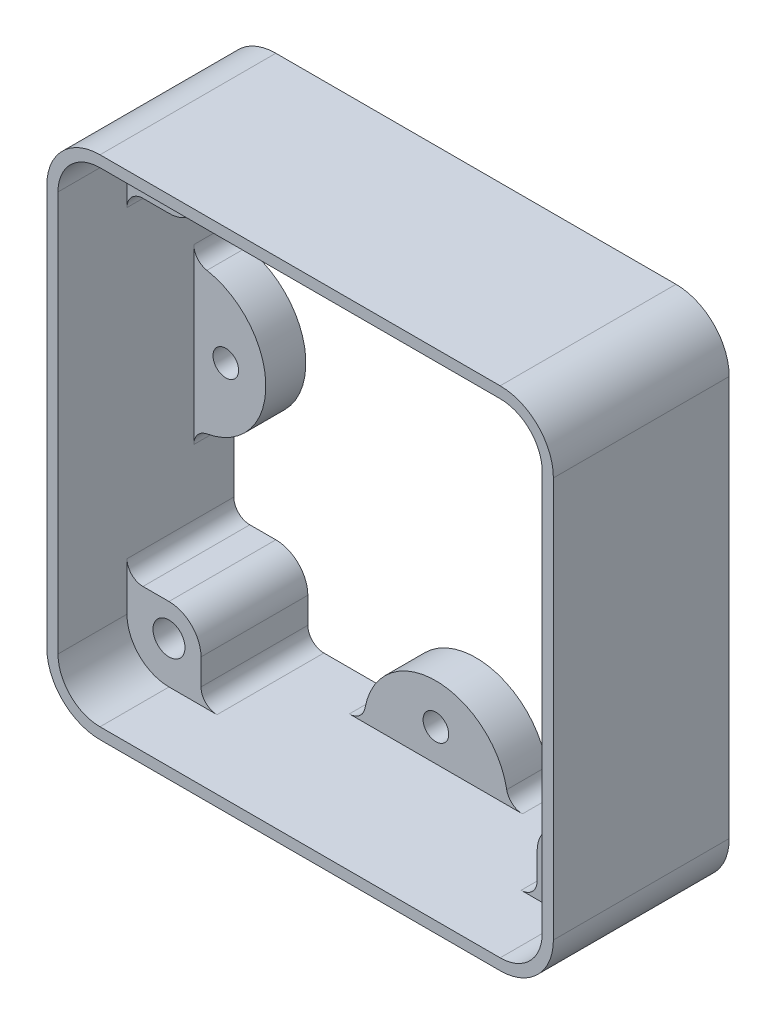
from build123d import *

# Parameters (mm, degrees)
BOSS_EXTRUDE1_DEPTH      = 7
BOSS_EXTRUDE1_DEPTH_BACK = 14.970201
BOSS_EXTRUDE2_START      = -14.970201
SKETCH2_R                = 2
BOSS_EXTRUDE2_DEPTH      = 13.350798149
BOSS_EXTRUDE3_START      = -14.970203
SKETCH3_R                = 1.6
BOSS_EXTRUDE3_DEPTH      = 5.000003
FILLET1_R                = 2


with BuildPart() as part:
    # Sketch1 → Boss-Extrude1 (new, two sides: drawn at the far end of the back side and taken through both)
    with BuildSketch(Plane.XY.offset(-BOSS_EXTRUDE1_DEPTH_BACK)):
        with BuildLine():
            Line((54.999742941, -1.649999966), (5.000257256, -1.649999966))
            ThreePointArc((5.000257256, -1.649999966), (0.297273819, 0.297273819), (-1.649999966, 5.000257256))
            Line((-1.649999966, 5.000257256), (-1.649999966, 54.999742941))
            ThreePointArc((-1.649999966, 54.999742941), (0.297274177, 59.702725823), (5.000257059, 61.649999966))
            Line((5.000257059, 61.649999966), (54.999743139, 61.649999966))
            ThreePointArc((54.999743139, 61.649999966), (59.702725466, 59.702725466), (61.649999966, 54.999743139))
            Line((61.649999966, 54.999743139), (61.649999966, 5.000257059))
            ThreePointArc((61.649999966, 5.000257059), (59.702725823, 0.297274177), (54.999742941, -1.649999966))
        make_face()
        with BuildLine():
            ThreePointArc((5.000039752, 60.249999994), (1.287223653, 58.712776347), (-0.249999994, 54.999960248))
            Line((-0.249999994, 54.999960248), (-0.249999994, 5.000039782))
            ThreePointArc((-0.249999994, 5.000039782), (1.287223296, 1.287223296), (5.000039782, -0.249999994))
            Line((5.000039782, -0.249999994), (54.999960248, -0.249999994))
            ThreePointArc((54.999960248, -0.249999994), (58.712776347, 1.287223653), (60.249999994, 5.000039752))
            Line((60.249999994, 5.000039752), (60.249999994, 54.999960279))
            ThreePointArc((60.249999994, 54.999960279), (58.712775989, 58.712775989), (54.999960279, 60.249999994))
            Line((54.999960279, 60.249999994), (5.000039752, 60.249999994))
        make_face(mode=Mode.SUBTRACT)
    extrude(amount=BOSS_EXTRUDE1_DEPTH + BOSS_EXTRUDE1_DEPTH_BACK)


with BuildPart() as boss_extrude2_tool:
    # Sketch2 → Boss-Extrude2 (new body)
    # profile 1 of 4: a face of its own
    with BuildSketch(Plane.XY.offset(BOSS_EXTRUDE2_START)):
        with BuildLine():
            Line((9.00000016, 54.99999922), (9.00000016, 60.249999994))
            Line((9.00000016, 60.249999994), (5.000039752, 60.249999994))
            add(Edge.make_bspline(
                [(-0.249999994, 54.999960248), (-0.250954892, 58.075921633), (1.924078367, 60.250954892), (5.000039752, 60.249999994)],
                knots=[0, 0, 0, 0, 1, 1, 1, 1], degree=3, weights=[1, 0.804591489, 0.804591489, 1]))
            Line((-0.249999994, 54.999960248), (-0.249999994, 50.99999922))
            Line((-0.249999994, 50.99999922), (5.00000016, 50.99999922))
            ThreePointArc((5.00000016, 50.99999922), (7.828427285, 52.171572095), (9.00000016, 54.99999922))
        make_face()
        with Locations(Location((5.00000016, 54.99999922, 0), (0, 0, 90))):
            Circle(SKETCH2_R, mode=Mode.SUBTRACT)
    # profile 2 of 4: a face of its own
    with BuildSketch(Plane.XY.offset(BOSS_EXTRUDE2_START)):
        with BuildLine():
            Line((50.99999922, 54.99999984), (50.99999922, 60.249999994))
            Line((50.99999922, 60.249999994), (54.999960248, 60.249999994))
            add(Edge.make_bspline(
                [(54.999960248, 60.249999994), (58.075921633, 60.250954892), (60.250954892, 58.075921633), (60.249999994, 54.999960248)],
                knots=[0, 0, 0, 0, 1, 1, 1, 1], degree=3, weights=[1, 0.804591489, 0.804591489, 1]))
            Line((60.249999994, 54.999960248), (60.249999994, 50.99999984))
            Line((60.249999994, 50.99999984), (54.99999922, 50.99999984))
            ThreePointArc((54.99999922, 50.99999984), (52.171572095, 52.171572715), (50.99999922, 54.99999984))
        make_face()
        with Locations(Location((54.99999922, 54.99999984, 0), (0, 0, 90))):
            Circle(SKETCH2_R, mode=Mode.SUBTRACT)
    # profile 3 of 4: a face of its own
    with BuildSketch(Plane.XY.offset(BOSS_EXTRUDE2_START)):
        with BuildLine():
            Line((54.99999984, 9.00000078), (60.249999994, 9.00000078))
            Line((60.249999994, 9.00000078), (60.249999994, 5.000039752))
            add(Edge.make_bspline(
                [(60.249999994, 5.000039752), (60.250954892, 1.924078367), (58.075921633, -0.250954892), (54.999960248, -0.249999994)],
                knots=[0, 0, 0, 0, 1, 1, 1, 1], degree=3, weights=[1, 0.804591489, 0.804591489, 1]))
            Line((54.999960248, -0.249999994), (50.99999984, -0.249999994))
            Line((50.99999984, -0.249999994), (50.99999984, 5.00000078))
            ThreePointArc((50.99999984, 5.00000078), (52.171572715, 7.828427905), (54.99999984, 9.00000078))
        make_face()
        with Locations(Location((54.99999984, 5.00000078, 0), (0, 0, 90))):
            Circle(SKETCH2_R, mode=Mode.SUBTRACT)
    # profile 4 of 4: a face of its own
    with BuildSketch(Plane.XY.offset(BOSS_EXTRUDE2_START)):
        with BuildLine():
            Line((9.00000078, 5.00000016), (9.00000078, -0.249999994))
            Line((9.00000078, -0.249999994), (5.000039752, -0.249999994))
            add(Edge.make_bspline(
                [(5.000039752, -0.249999994), (1.924078367, -0.250954892), (-0.250954892, 1.924078367), (-0.249999994, 5.000039752)],
                knots=[0, 0, 0, 0, 1, 1, 1, 1], degree=3, weights=[1, 0.804591489, 0.804591489, 1]))
            Line((-0.249999994, 5.000039752), (-0.249999994, 9.00000016))
            Line((-0.249999994, 9.00000016), (5.00000078, 9.00000016))
            ThreePointArc((5.00000078, 9.00000016), (7.828427905, 7.828427285), (9.00000078, 5.00000016))
        make_face()
        with Locations(Location((5.00000078, 5.00000016, 0), (0, 0, 90))):
            Circle(SKETCH2_R, mode=Mode.SUBTRACT)
    extrude(amount=BOSS_EXTRUDE2_DEPTH)


with BuildPart() as part_1:
    add(part.part)


with BuildPart() as part_2:
    # Boss-Extrude2: joined with boss_extrude2_tool
    add(part_1.part.fuse(boss_extrude2_tool.part, tol=0.00001))

    # Sketch3 → Boss-Extrude3 (add)
    # profile 1 of 4: a face of its own
    with BuildSketch(Plane.XY.offset(BOSS_EXTRUDE3_START)):
        with BuildLine():
            Line((60.249999994, 20.999999985), (60.249999994, 38.999999985))
            ThreePointArc((60.249999994, 38.999999985), (51.249999994, 29.999999985), (60.249999994, 20.999999985))
        make_face()
        with Locations(Location((56.249999994, 29.999999985, 0), (0, 0, 180))):
            Circle(SKETCH3_R, mode=Mode.SUBTRACT)
    # profile 2 of 4: a face of its own
    with BuildSketch(Plane.XY.offset(BOSS_EXTRUDE3_START)):
        with BuildLine():
            Line((39.000000015, 60.249999994), (21.000000015, 60.249999994))
            ThreePointArc((21.000000015, 60.249999994), (30.000000015, 51.249999994), (39.000000015, 60.249999994))
        make_face()
        with Locations(Location((30.000000015, 56.249999994, 0), (0, 0, 180))):
            Circle(SKETCH3_R, mode=Mode.SUBTRACT)
    # profile 3 of 4: a face of its own
    with BuildSketch(Plane.XY.offset(BOSS_EXTRUDE3_START)):
        with BuildLine():
            Line((20.999999985, -0.249999994), (38.999999985, -0.249999994))
            ThreePointArc((38.999999985, -0.249999994), (29.999999985, 8.750000006), (20.999999985, -0.249999994))
        make_face()
        with Locations(Location((29.999999985, 3.750000006, 0), (0, 0, 180))):
            Circle(SKETCH3_R, mode=Mode.SUBTRACT)
    # profile 4 of 4: a face of its own
    with BuildSketch(Plane.XY.offset(BOSS_EXTRUDE3_START)):
        with BuildLine():
            Line((-0.249999994, 39.000000015), (-0.249999994, 21.000000015))
            ThreePointArc((-0.249999994, 21.000000015), (8.750000006, 30.000000015), (-0.249999994, 39.000000015))
        make_face()
        with Locations(Location((3.750000006, 30.000000015, 0), (0, 0, 180))):
            Circle(SKETCH3_R, mode=Mode.SUBTRACT)
    extrude(amount=BOSS_EXTRUDE3_DEPTH)

    # Fillet1
    fillet1_edges = [part_2.edges().sort_by_distance(p)[0] for p in [
        (-0.249999994, 50.99999922, -8.294801925),
        (9.00000016, 60.249999994, -8.294801925),
        (50.99999922, 60.249999994, -8.294801925),
        (60.249999994, 50.99999984, -8.294801925),
        (60.249999994, 9.00000078, -8.294801925),
        (50.99999984, -0.249999994, -8.294801925),
        (9.00000078, -0.249999994, -8.294801925),
        (-0.249999994, 9.00000016, -8.294801925),
        (21.000000015, 60.249999994, -12.4702005),
        (39.000000015, 60.249999994, -12.4702005),
        (60.249999994, 38.999999985, -12.4702005),
        (60.249999994, 20.999999985, -12.4702005),
        (38.999999985, -0.249999994, -12.4702005),
        (20.999999985, -0.249999994, -12.4702005),
        (-0.249999994, 21.000000015, -12.4702005),
        (-0.249999994, 39.000000015, -12.4702005),
    ]]
    fillet(fillet1_edges, radius=FILLET1_R)


solid = part_2.part
